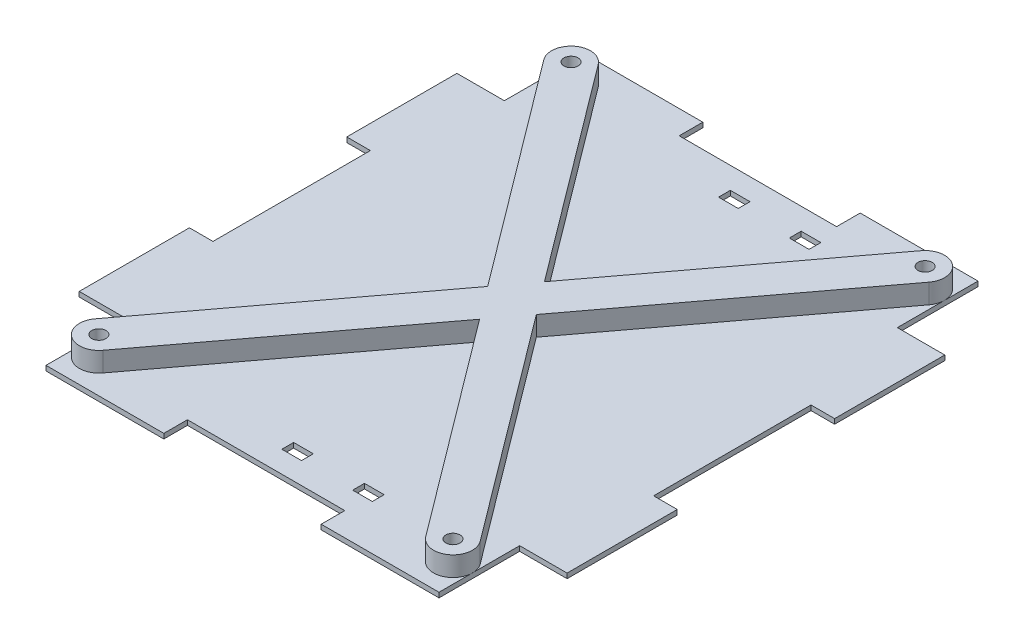
from build123d import *

# Parameters (mm, degrees)
SKETCH1_R           = 2.286
MAIN_BODY_DEPTH     = 1.5875
CUT_EXTRUDE1_REACH  = 119.348
SKETCH2_W           = 6.35
SKETCH2_H           = 3.81
SKETCH3_R           = 2.286
BOSS_EXTRUDE1_DEPTH = 6.35


with BuildPart() as part:
    # Sketch1 → Main Body (new body)
    with BuildSketch(Plane(origin=(0, 0, 0), x_dir=(1, 0, 0), z_dir=(0, 1, 0))):
        Polygon((-25.4, 86.995), (-63.43142, 86.995), (-63.43142, 60.96), (-78.74, 60.96), (-78.74, 25.4), (-71.12, 25.4), (-71.12, -25.4), (-78.74, -25.4), (-78.74, -60.96), (-63.43142, -60.96), (-63.43142, -86.995), (-25.4, -86.995), (-25.4, -79.375), (25.4, -79.375), (25.4, -86.995), (63.43142, -86.995), (63.43142, -60.96), (78.74, -60.96), (78.74, -25.4), (71.12, -25.4), (71.12, 25.4), (78.74, 25.4), (78.74, 60.96), (63.43142, 60.96), (63.43142, 86.995), (25.4, 86.995), (25.4, 79.375), (-25.4, 79.375), align=None)
        with Locations((-57.15, 76.2)):
            Circle(SKETCH1_R, mode=Mode.SUBTRACT)
        with Locations((57.15, 76.2)):
            Circle(SKETCH1_R, mode=Mode.SUBTRACT)
        with Locations((57.15, -76.2)):
            Circle(SKETCH1_R, mode=Mode.SUBTRACT)
        with Locations((-57.15, -76.2)):
            Circle(SKETCH1_R, mode=Mode.SUBTRACT)
    extrude(amount=MAIN_BODY_DEPTH)

    # Sketch2 → Cut-Extrude1 (cut, up to next)
    with BuildSketch(Plane(origin=(0, 1.5875, 0), x_dir=(1, 0, 0), z_dir=(0, 1, 0)), mode=Mode.PRIVATE) as cut_extrude1_sk1:
        with Locations((1.27, -70.485)):
            Rectangle(SKETCH2_W, SKETCH2_H)
    cut_extrude1_tool1 = extrude(cut_extrude1_sk1.sketch, amount=-CUT_EXTRUDE1_REACH, mode=Mode.PRIVATE) & part.part
    # Sketch2 → Cut-Extrude1 (cut, up to next)
    with BuildSketch(Plane(origin=(0, 1.5875, 0), x_dir=(1, 0, 0), z_dir=(0, 1, 0)), mode=Mode.PRIVATE) as cut_extrude1_sk2:
        with Locations((24.13, -70.485)):
            Rectangle(SKETCH2_W, SKETCH2_H)
    cut_extrude1_tool2 = extrude(cut_extrude1_sk2.sketch, amount=-CUT_EXTRUDE1_REACH, mode=Mode.PRIVATE) & part.part
    # Sketch2 → Cut-Extrude1 (cut, up to next)
    with BuildSketch(Plane(origin=(0, 1.5875, 0), x_dir=(1, 0, 0), z_dir=(0, 1, 0)), mode=Mode.PRIVATE) as cut_extrude1_sk3:
        with Locations((1.27, 70.485)):
            Rectangle(SKETCH2_W, SKETCH2_H)
    cut_extrude1_tool3 = extrude(cut_extrude1_sk3.sketch, amount=-CUT_EXTRUDE1_REACH, mode=Mode.PRIVATE) & part.part
    # Sketch2 → Cut-Extrude1 (cut, up to next)
    with BuildSketch(Plane(origin=(0, 1.5875, 0), x_dir=(1, 0, 0), z_dir=(0, 1, 0)), mode=Mode.PRIVATE) as cut_extrude1_sk4:
        with Locations((24.13, 70.485)):
            Rectangle(SKETCH2_W, SKETCH2_H)
    cut_extrude1_tool4 = extrude(cut_extrude1_sk4.sketch, amount=-CUT_EXTRUDE1_REACH, mode=Mode.PRIVATE) & part.part
    add(cut_extrude1_tool1.solids().sort_by_distance((1.27, 1.5875, 70.485))[0], mode=Mode.SUBTRACT)
    add(cut_extrude1_tool2.solids().sort_by_distance((24.13, 1.5875, 70.485))[0], mode=Mode.SUBTRACT)
    add(cut_extrude1_tool3.solids().sort_by_distance((1.27, 1.5875, -70.485))[0], mode=Mode.SUBTRACT)
    add(cut_extrude1_tool4.solids().sort_by_distance((24.13, 1.5875, -70.485))[0], mode=Mode.SUBTRACT)

    # Sketch3 → Boss-Extrude1 (add)
    with BuildSketch(Plane(origin=(0, 1.5875, 0), x_dir=(1, 0, 0), z_dir=(0, 1, 0))):
        with BuildLine():
            Line((0, -10.469033333), (52.124864, -79.968852))
            ThreePointArc((52.124864, -79.968852), (60.918852, -81.225136), (62.175136, -72.431148))
            Line((62.175136, -72.431148), (7.851775, 0))
            Line((7.851775, 0), (62.175136, 72.431148))
            ThreePointArc((62.175136, 72.431148), (60.918852, 81.225136), (52.124864, 79.968852))
            Line((52.124864, 79.968852), (0, 10.469033333))
            Line((0, 10.469033333), (-52.124864, 79.968852))
            ThreePointArc((-52.124864, 79.968852), (-60.918852, 81.225136), (-62.175136, 72.431148))
            Line((-62.175136, 72.431148), (-7.851775, 0))
            Line((-7.851775, 0), (-62.175136, -72.431148))
            ThreePointArc((-62.175136, -72.431148), (-60.918852, -81.225136), (-52.124864, -79.968852))
            Line((-52.124864, -79.968852), (0, -10.469033333))
        make_face()
        with Locations((57.15, -76.2)):
            Circle(SKETCH3_R, mode=Mode.SUBTRACT)
        with Locations((-57.15, -76.2)):
            Circle(SKETCH3_R, mode=Mode.SUBTRACT)
        with Locations((-57.15, 76.2)):
            Circle(SKETCH3_R, mode=Mode.SUBTRACT)
        with Locations((57.15, 76.2)):
            Circle(SKETCH3_R, mode=Mode.SUBTRACT)
    extrude(amount=BOSS_EXTRUDE1_DEPTH)


solid = part.part
